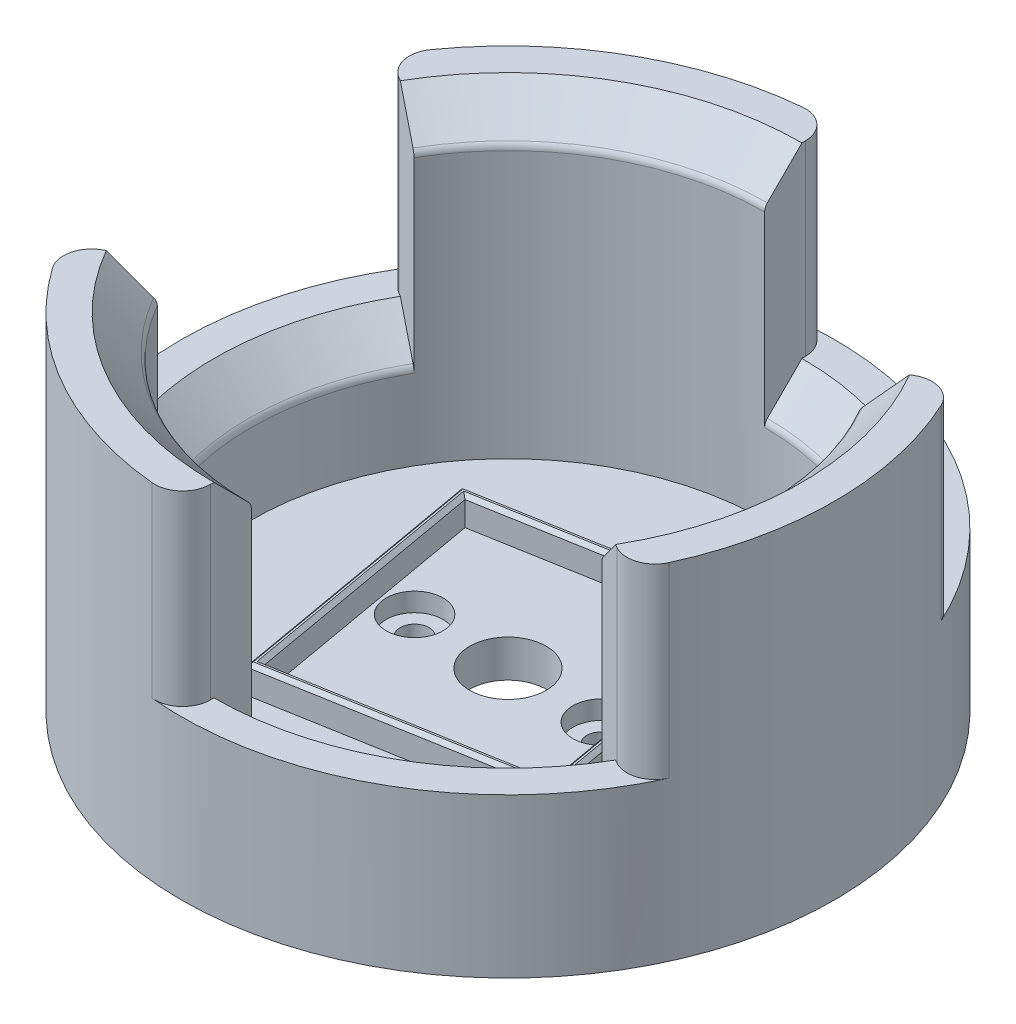
from build123d import *

# Parameters (mm, degrees)
SKETCH_1_R               = 35.00000000000001
SKETCH_1_R_2             = 27.5
EXTRUDE_1_DEPTH          = 33
EXTRUDE_START            = -4
SKETCH_1_5_R             = 35.00000000000001
EXTRUDE_2_DEPTH          = 4
CHAMFER_1_SIZE           = 4
FILLET_1_R               = 1
SKETCH_3_R               = 3.0500000000000043
SKETCH_3_R_2             = 3.0500000000000034
CUT_EXTRUDE_1_DEPTH      = 2
SKETCH_4_R               = 1.5499999999999994
CUT_EXTRUDE_3_DEPTH      = 7.500000000000001
SKETCH_6_R               = 4.1
CUT_EXTRUDE_4_DEPTH      = 5
CUT_EXTRUDE_START        = 13
CUT_EXTRUDE_5_DEPTH      = 47.489494926415375
PATTERN_CIRCULAR_2_COUNT = 3
CHAMFER_2_SIZE           = 4
FILLET_2_R               = 1
FILLET_3_R               = 3
EXTRUDE_3_DEPTH          = 3
CHAMFER_3_SIZE           = 0.4


with BuildPart() as part:
    # 草图1 → 凸台-拉伸1 (new body)
    with BuildSketch(Plane(origin=(0, 0, 0), x_dir=(1, 0, 0), z_dir=(0, 1, 0))):
        Circle(SKETCH_1_R)
        Circle(SKETCH_1_R_2, mode=Mode.SUBTRACT)
    extrude(amount=EXTRUDE_1_DEPTH)

    # 草图1<5> → 凸台-拉伸2 (add)
    with BuildSketch(Plane(origin=(0, 0, 0), x_dir=(1, 0, 0), z_dir=(0, 1, 0)).offset(EXTRUDE_START)):
        Circle(SKETCH_1_5_R)
    extrude(amount=EXTRUDE_2_DEPTH)

    # 倒角1
    chamfer_1_edges = [part.edges().sort_by_distance(p)[0] for p in [
        (-27.5, 33, -3.37e-15),
    ]]
    chamfer(chamfer_1_edges, length=CHAMFER_1_SIZE)

    # 圆角1
    fillet_1_edges = [part.edges().sort_by_distance(p)[0] for p in [
        (-27.5, 29, -3.37e-15),
    ]]
    fillet(fillet_1_edges, radius=FILLET_1_R)

    # 草图3 → 切除-拉伸1 (cut)
    with BuildSketch(Plane(origin=(0, 0, 0), x_dir=(1, 0, 0), z_dir=(0, 1, 0))):
        with Locations((10, 6.7e-16)):
            Circle(SKETCH_3_R)
        with Locations((-10, 0)):
            Circle(SKETCH_3_R_2)
    extrude(amount=-CUT_EXTRUDE_1_DEPTH, mode=Mode.SUBTRACT)

    # 草图4 → 切除-拉伸3 (cut)
    with BuildSketch(Plane(origin=(0, -2, 0), x_dir=(1, 0, 0), z_dir=(0, 1, 0))):
        with Locations((-10, 0)):
            Circle(SKETCH_4_R)
        with Locations((10, 0)):
            Circle(SKETCH_4_R)
    extrude(amount=-CUT_EXTRUDE_3_DEPTH, mode=Mode.SUBTRACT)

    # 草图6 → 切除-拉伸4 (cut)
    with BuildSketch(Plane(origin=(0, 0, 0), x_dir=(1, 0, 0), z_dir=(0, 1, 0))):
        Circle(SKETCH_6_R)
    extrude(amount=-CUT_EXTRUDE_4_DEPTH, mode=Mode.SUBTRACT)

    # 草图7 → 切除-拉伸5 (cut, through all)
    with BuildSketch(Plane(origin=(0, 0, 0), x_dir=(1, 0, 0), z_dir=(0, 1, 0)).offset(CUT_EXTRUDE_START)):
        with BuildLine():
            Line((0, 0), (-1.224e-13, -35.00000000000001))
            ThreePointArc((-1.224e-13, -35.00000000000001), (17.499999999999932, -30.3108891324554), (30.31088913245534, -17.50000000000004))
            Line((30.31088913245534, -17.50000000000004), (0, 0))
        make_face()
    cut_extrude_5 = extrude(amount=CUT_EXTRUDE_5_DEPTH, mode=Mode.SUBTRACT)

    # 阵列(圆周)2: 切除-拉伸5 ×3 about axis
    pattern_circular_2_axis = Axis((0, 33, 0), (0, -1, 0))
    for i in range(1, PATTERN_CIRCULAR_2_COUNT):
        add(cut_extrude_5.rotate(pattern_circular_2_axis, i * 360 / PATTERN_CIRCULAR_2_COUNT), mode=Mode.SUBTRACT)

    # 倒角2
    chamfer_2_edges = [part.edges().sort_by_distance(p)[0] for p in [
        (13.750000000000025, 13, -23.81569860407205),
        (13.749999999999945, 13, 23.815698604072097),
        (-27.5, 13, -4.548e-14),
    ]]
    chamfer(chamfer_2_edges, length=CHAMFER_2_SIZE)

    # 圆角2
    fillet_2_edges = [part.edges().sort_by_distance(p)[0] for p in [
        (13.749999999999945, 9, 23.815698604072093),
        (13.750000000000043, 9, -23.81569860407204),
        (-27.5, 9, -6.04e-14),
    ]]
    fillet(fillet_2_edges, radius=FILLET_2_R)

    # 圆角3
    fillet_3_edges = [part.edges().sort_by_distance(p)[0] for p in [
        (-30.310889132455372, 23, 17.49999999999998),
        (-1.224e-13, 23, 35.00000000000001),
        (30.310889132455344, 23, 17.500000000000036),
        (30.310889132455408, 23, -17.49999999999991),
        (-30.3108891324553, 23, -17.500000000000103),
        (1.599e-14, 23, -35.000000000000014),
    ]]
    fillet(fillet_3_edges, radius=FILLET_3_R)

    # 草图8 → 凸台-拉伸3 (add)
    with BuildSketch(Plane(origin=(0, 0, 0), x_dir=(1, 0, 0), z_dir=(0, 1, 0))):
        Polygon((11.55902394867032, 16.507997012177636), (-16.507997012177643, 11.559023948670312), (-11.559023948670319, -16.507997012177647), (16.507997012177647, -11.559023948670319), align=None)
        Polygon((-15.349541081498513, 10.747864373325031), (-10.747864373325033, -15.349541081498513), (15.349541081498513, -10.747864373325033), (10.747864373325033, 15.349541081498511), align=None, mode=Mode.SUBTRACT)
    extrude(amount=EXTRUDE_3_DEPTH)

    # 倒角3
    chamfer_3_edges = [part.edges().sort_by_distance(p)[0] for p in [
        (14.033510480423985, 3, -2.4744865317536586),
        (2.474486531753664, 3, 14.033510480423983),
        (-14.033510480423981, 3, 2.4744865317536675),
        (-2.4744865317536604, 3, -14.033510480423974),
        (-2.300838354086739, 3, -13.048702727411772),
        (13.048702727411772, 3, -2.300838354086739),
        (2.300838354086739, 3, 13.048702727411772),
        (-13.048702727411772, 3, 2.300838354086741),
    ]]
    chamfer(chamfer_3_edges, length=CHAMFER_3_SIZE)


solid = part.part
